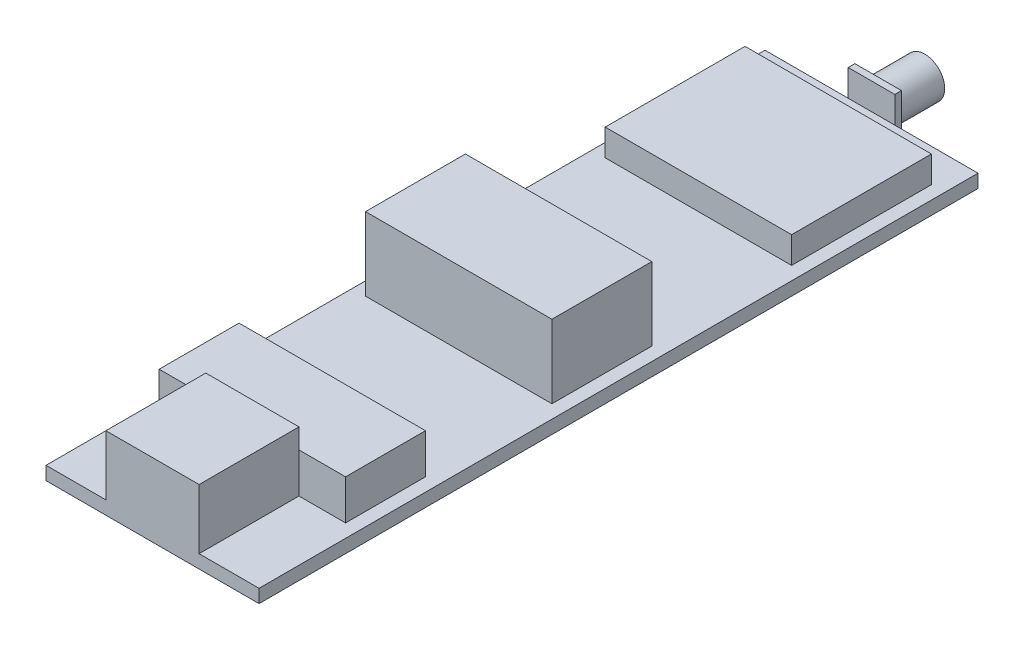
from build123d import *

# Parameters (mm, degrees)
SKETCH_1_W         = 32
SKETCH_1_H         = 108
EXTRUDE_404_DEPTH  = 2
SKETCH_3_W         = 14
SKETCH_3_H         = 15
ETHERNET_DEPTH     = 9
SKETCH_4_W         = 28
SKETCH_4_H         = 12
EXTRUDE_1020_DEPTH = 6
SKETCH_5_W         = 28
SKETCH_5_H         = 15
EXTRUDE_1244_DEPTH = 11
SKETCH_6_W         = 28
SKETCH_6_H         = 21
EXTRUDE_1516_DEPTH = 4
SKETCH_7_W         = 7
SKETCH_7_H         = 7
SMA_DEPTH          = 1
SKETCH_8_R         = 3
SMA_2_DEPTH        = 7


with BuildPart() as part:
    # Sketch 1 → Extrude 404 (new body)
    with BuildSketch(Plane(origin=(0, 0, 0), x_dir=(1, 0, 0), z_dir=(0, 1, 0))):
        Rectangle(SKETCH_1_W, SKETCH_1_H)
    extrude(amount=EXTRUDE_404_DEPTH)

    # Sketch 3 → ethernet (add)
    with BuildSketch(Plane(origin=(0, 2, 0), x_dir=(1, 0, 0), z_dir=(0, 1, 0))):
        with Locations((0, -46.5)):
            Rectangle(SKETCH_3_W, SKETCH_3_H)
    extrude(amount=ETHERNET_DEPTH)

    # Sketch 4 → Extrude 1020 (add)
    with BuildSketch(Plane(origin=(0, 2, 0), x_dir=(1, 0, 0), z_dir=(0, 1, 0))):
        with Locations((0, -33)):
            Rectangle(SKETCH_4_W, SKETCH_4_H)
    extrude(amount=EXTRUDE_1020_DEPTH)

    # Sketch 5 → Extrude 1244 (add)
    with BuildSketch(Plane(origin=(0, 2, 0), x_dir=(1, 0, 0), z_dir=(0, 1, 0))):
        with Locations((0, -0.5)):
            Rectangle(SKETCH_5_W, SKETCH_5_H)
    extrude(amount=EXTRUDE_1244_DEPTH)

    # Sketch 6 → Extrude 1516 (add)
    with BuildSketch(Plane(origin=(0, 2, 0), x_dir=(1, 0, 0), z_dir=(0, 1, 0))):
        with Locations((0, 38.5)):
            Rectangle(SKETCH_6_W, SKETCH_6_H)
    extrude(amount=EXTRUDE_1516_DEPTH)

    # Sketch 7 → sma (add)
    with BuildSketch(Plane(origin=(0, 0, -54), x_dir=(-1, 0, 0), z_dir=(0, 0, -1))):
        with Locations((0, 2.5)):
            Rectangle(SKETCH_7_W, SKETCH_7_H)
    extrude(amount=SMA_DEPTH)

    # Sketch 8 → sma 2 (add)
    with BuildSketch(Plane(origin=(0, 0, -55), x_dir=(-1, 0, 0), z_dir=(0, 0, -1))):
        with Locations((0, 2.5)):
            Circle(SKETCH_8_R)
    extrude(amount=SMA_2_DEPTH)


solid = part.part
